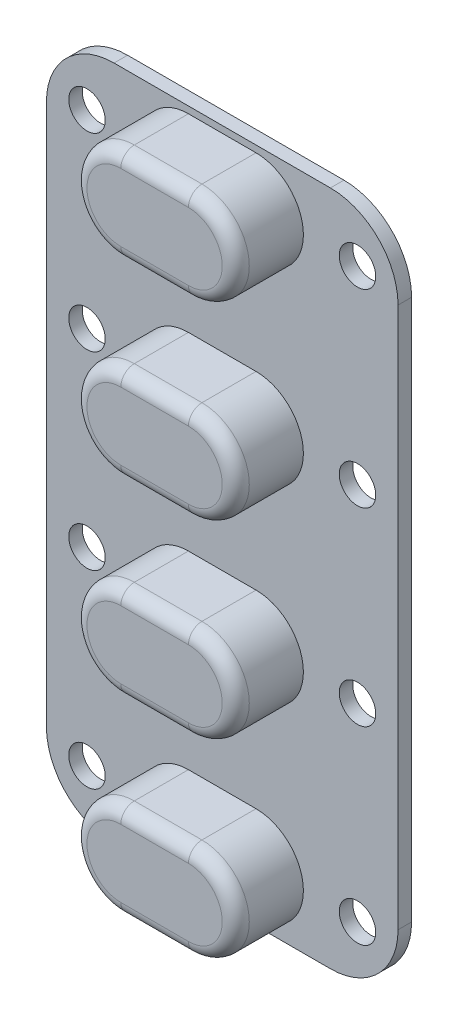
from build123d import *

# Parameters (mm, degrees)
SKETCH1_W           = 26
SKETCH1_H           = 50
SKETCH1_R           = 1.35
BOSS_EXTRUDE1_DEPTH = 1
BOSS_EXTRUDE2_DEPTH = 5
FILLET1_R           = 1
FILLET2_R           = 5
SKETCH3_R           = 2.5
CUT_EXTRUDE1_DEPTH  = 3


with BuildPart() as part:
    # Sketch1 → Boss-Extrude1 (new body)
    with BuildSketch(Plane.XY):
        Rectangle(SKETCH1_W, SKETCH1_H)
        with Locations((10, -21)):
            Circle(SKETCH1_R, mode=Mode.SUBTRACT)
        with Locations((10, -7)):
            Circle(SKETCH1_R, mode=Mode.SUBTRACT)
        with Locations((10, 7)):
            Circle(SKETCH1_R, mode=Mode.SUBTRACT)
        with Locations((10, 21)):
            Circle(SKETCH1_R, mode=Mode.SUBTRACT)
        with Locations((-10, -7)):
            Circle(SKETCH1_R, mode=Mode.SUBTRACT)
        with Locations((-10, 7)):
            Circle(SKETCH1_R, mode=Mode.SUBTRACT)
        with Locations((-10, 21)):
            Circle(SKETCH1_R, mode=Mode.SUBTRACT)
        with Locations((-10, -21)):
            Circle(SKETCH1_R, mode=Mode.SUBTRACT)
    extrude(amount=BOSS_EXTRUDE1_DEPTH)

    # Sketch2 → Boss-Extrude2 (add)
    with BuildSketch(Plane.XY.offset(1)):
        with BuildLine():
            Line((-2.5, 24.5), (2.5, 24.5))
            ThreePointArc((2.5, 24.5), (6, 21), (2.5, 17.5))
            Line((2.5, 17.5), (-2.5, 17.5))
            ThreePointArc((-2.5, 17.5), (-6, 21), (-2.5, 24.5))
        make_face()
        with BuildLine():
            Line((-2.5, 3.5), (2.5, 3.5))
            ThreePointArc((2.5, 3.5), (6, 7), (2.5, 10.5))
            Line((2.5, 10.5), (-2.5, 10.5))
            ThreePointArc((-2.5, 10.5), (-6, 7), (-2.5, 3.5))
        make_face()
        with BuildLine():
            Line((-2.5, -10.5), (2.5, -10.5))
            ThreePointArc((2.5, -10.5), (6, -7), (2.5, -3.5))
            Line((2.5, -3.5), (-2.5, -3.5))
            ThreePointArc((-2.5, -3.5), (-6, -7), (-2.5, -10.5))
        make_face()
        with BuildLine():
            Line((-2.5, -24.5), (2.5, -24.5))
            ThreePointArc((2.5, -24.5), (6, -21), (2.5, -17.5))
            Line((2.5, -17.5), (-2.5, -17.5))
            ThreePointArc((-2.5, -17.5), (-6, -21), (-2.5, -24.5))
        make_face()
    extrude(amount=BOSS_EXTRUDE2_DEPTH)

    # Fillet1
    fillet1_edges = [part.edges().sort_by_distance(p)[0] for p in [
        (0, -17.5, 6),
        (6, -21, 6),
        (0, -24.5, 6),
        (-6, -21, 6),
        (0, -3.5, 6),
        (6, -7, 6),
        (0, -10.5, 6),
        (-6, -7, 6),
        (0, 10.5, 6),
        (6, 7, 6),
        (0, 3.5, 6),
        (-6, 7, 6),
        (0, 24.5, 6),
        (6, 21, 6),
        (0, 17.5, 6),
        (-6, 21, 6),
    ]]
    fillet(fillet1_edges, radius=FILLET1_R)

    # Fillet2
    fillet2_edges = [part.edges().sort_by_distance(p)[0] for p in [
        (13, 25, 0.5),
        (-13, 25, 0.5),
        (13, -25, 0.5),
        (-13, -25, 0.5),
    ]]
    fillet(fillet2_edges, radius=FILLET2_R)

    # Sketch3 → Cut-Extrude1 (cut)
    with BuildSketch(Plane(origin=(0, 0, 0), x_dir=(-1, 0, 0), z_dir=(0, 0, -1))):
        with Locations((0, 21)):
            Circle(SKETCH3_R)
        with Locations((0, 7)):
            Circle(SKETCH3_R)
        with Locations((0, -7)):
            Circle(SKETCH3_R)
        with Locations((0, -21)):
            Circle(SKETCH3_R)
    extrude(amount=-CUT_EXTRUDE1_DEPTH, mode=Mode.SUBTRACT)


solid = part.part
